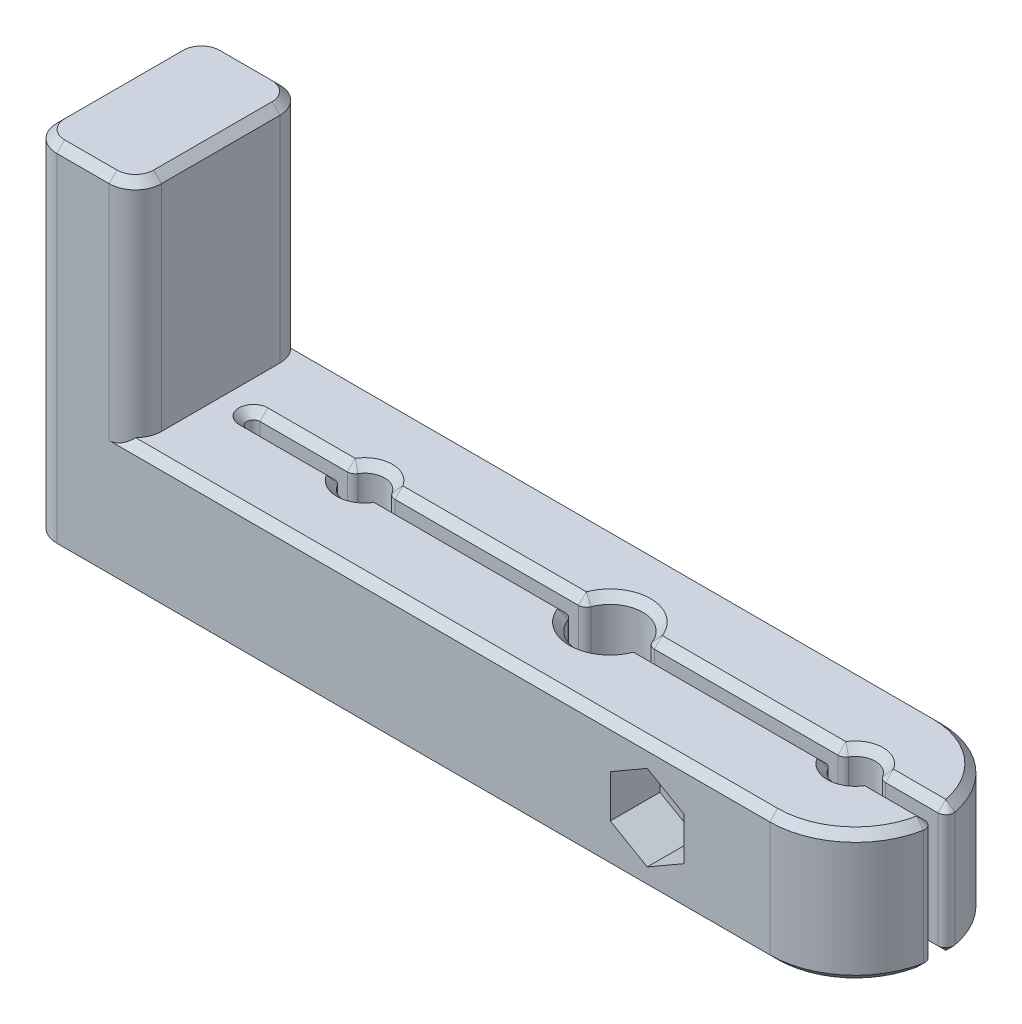
from build123d import *

# Parameters (mm, degrees)
SKETCH1_R               = 1.525
SKETCH1_R_2             = 2.5
SKETCH1_R_3             = 1.5
MAIN_BODY_DEPTH         = 10
SKETCH1_4_R             = 2.5
LEAD_SCREW_CUTOUT_DEPTH = 40.593410121
LIMIT_SWITCH_TAB_DEPTH  = 17
CUT_EXTRUDE1_DEPTH      = 42.912266999
FILLET1_R               = 0.6
CHAMFER1_SIZE           = 0.6
CUT_EXTRUDE2_DEPTH      = 3.8
CUT_EXTRUDE3_DEPTH      = 49.211668712
CUT_EXTRUDE4_DEPTH      = 3.3


with BuildPart() as part:
    # Sketch1 → Main body (new body)
    # profile 1 of 3: a face of its own
    with BuildSketch(Plane(origin=(0, 0, 0), x_dir=(1, 0, 0), z_dir=(0, 1, 0))):
        with BuildLine():
            Line((18.75, 6.525), (-18.75, 6.525))
            Line((-18.75, 6.525), (-35.75, 6.525))
            ThreePointArc((-35.75, 6.525), (-37.164213562, 5.939213562), (-37.75, 4.525))
            Line((-37.75, 4.525), (-37.75, -4.525))
            ThreePointArc((-37.75, -4.525), (-37.164213562, -5.939213562), (-35.75, -6.525))
            Line((-35.75, -6.525), (-18.75, -6.525))
            Line((-18.75, -6.525), (18.75, -6.525))
            ThreePointArc((18.75, -6.525), (25.275, 0), (18.75, 6.525))
        make_face()
        with Locations(Location((-18.75, 0, 0), (0, 0, 270))):
            Circle(SKETCH1_R, mode=Mode.SUBTRACT)
        Circle(SKETCH1_R_2, mode=Mode.SUBTRACT)
        with Locations(Location((18.75, 0, 0), (0, 0, 270))):
            Circle(SKETCH1_R, mode=Mode.SUBTRACT)
    # profile 2 of 3: a face of its own
    with BuildSketch(Plane(origin=(0, 0, 0), x_dir=(1, 0, 0), z_dir=(0, 1, 0))):
        Circle(SKETCH1_R_2)
        Circle(SKETCH1_R_3, mode=Mode.SUBTRACT)
    # profile 3 of 3: a face of its own
    with BuildSketch(Plane(origin=(0, 0, 0), x_dir=(1, 0, 0), z_dir=(0, 1, 0))):
        Circle(SKETCH1_R_3)
    extrude(amount=MAIN_BODY_DEPTH)

    # Sketch1<4> → Lead screw cutout (cut, through all)
    with BuildSketch(Plane(origin=(0, 0, 0), x_dir=(1, 0, 0), z_dir=(0, 1, 0))):
        with Locations(Location((0, 0, 0), (0, 0, 270))):
            Circle(SKETCH1_4_R)
    extrude(amount=LEAD_SCREW_CUTOUT_DEPTH, mode=Mode.SUBTRACT)

    # Limit switch tab sketch → Limit switch tab (add)
    with BuildSketch(Plane(origin=(0, 10, 0), x_dir=(1, 0, 0), z_dir=(0, 1, 0))):
        with BuildLine():
            Line((-37.75, 4.525), (-37.75, -4.525))
            ThreePointArc((-37.75, -4.525), (-37.164213562, -5.939213562), (-35.75, -6.525))
            Line((-35.75, -6.525), (-31.75, -6.525))
            ThreePointArc((-31.75, -6.525), (-30.335786438, -5.939213562), (-29.75, -4.525))
            Line((-29.75, -4.525), (-29.75, 4.525))
            ThreePointArc((-29.75, 4.525), (-30.335786438, 5.939213562), (-31.75, 6.525))
            Line((-31.75, 6.525), (-35.75, 6.525))
            ThreePointArc((-35.75, 6.525), (-37.164213562, 5.939213562), (-37.75, 4.525))
        make_face()
    extrude(amount=LIMIT_SWITCH_TAB_DEPTH)

    # Sketch2 → Cut-Extrude1 (cut, through all)
    with BuildSketch(Plane(origin=(0, 10, 0), x_dir=(1, 0, 0), z_dir=(0, 1, 0))):
        with BuildLine():
            Line((-27.25, 0.5), (27.993605311, 0.5))
            Line((27.993605311, 0.5), (27.993605311, -0.5))
            Line((27.993605311, -0.5), (-27.25, -0.5))
            ThreePointArc((-27.25, -0.5), (-27.75, 0), (-27.25, 0.5))
        make_face()
    extrude(amount=-CUT_EXTRUDE1_DEPTH, mode=Mode.SUBTRACT)

    # Fillet1
    fillet1_edges = [part.edges().sort_by_distance(p)[0] for p in [
        (2.449489743, 5, 0.5),
        (-2.449489743, 5, 0.5),
        (-2.449489743, 5, -0.5),
        (2.449489743, 5, -0.5),
        (-17.309297047, 5, -0.5),
        (-20.190702953, 5, -0.5),
        (20.190702953, 5, -0.5),
        (17.309297047, 5, -0.5),
        (25.255814707, 5, -0.5),
        (-20.190702953, 5, 0.5),
        (-17.309297047, 5, 0.5),
        (17.309297047, 5, 0.5),
        (20.190702953, 5, 0.5),
        (25.255814707, 5, 0.5),
    ]]
    fillet(fillet1_edges, radius=FILLET1_R)

    # Chamfer1
    chamfer1_edges = [part.edges().sort_by_distance(p)[0] for p in [
        (22.913609585, 0, -5.023940706),
        (-8.5, 0, 6.525),
        (-37.164213562, 0, 5.939213562),
        (-37.75, 0, 0),
        (9.915068783, 10, -0.5),
        (9.915068783, 0, -0.5),
        (22.570066358, 0, -0.5),
        (-37.164213562, 0, -5.939213562),
        (18.75, 0, -1.525),
        (0, 0, -2.5),
        (-9.915068783, 0, -0.5),
        (-18.75, 0, -1.525),
        (-23.909068892, 0, -0.5),
        (-18.75, 0, 1.525),
        (-9.915068783, 0, 0.5),
        (0, 0, 2.5),
        (-8.5, 0, -6.525),
        (9.915068783, 0, 0.5),
        (18.75, 0, 1.525),
        (22.570066358, 0, 0.5),
        (22.913609585, 0, 5.023940706),
        (-20.273479457, 0, -0.577337135),
        (-17.226520543, 0, -0.577337135),
        (-20.273479457, 0, 0.577337135),
        (-17.226520543, 0, 0.577337135),
        (-2.557498249, 0, 0.606167065),
        (-2.557498249, 0, -0.606167065),
        (2.557498249, 0, 0.606167065),
        (17.226520543, 0, -0.577337135),
        (17.226520543, 0, 0.577337135),
        (20.273479457, 0, 0.577337135),
        (20.273479457, 0, -0.577337135),
        (25.033966492, 0, -0.717139348),
        (25.033966492, 0, 0.717139348),
        (2.557498249, 0, -0.606167065),
        (0, 10, -2.5),
        (22.570066358, 10, -0.5),
        (22.913609585, 10, 5.023940706),
        (22.570066358, 10, 0.5),
        (18.75, 10, 1.525),
        (9.915068783, 10, 0.5),
        (0, 10, 2.5),
        (-9.915068783, 10, 0.5),
        (-18.75, 10, 1.525),
        (-23.909068892, 10, -0.5),
        (-18.75, 10, -1.525),
        (-9.915068783, 10, -0.5),
        (18.75, 10, -1.525),
        (-20.273479457, 10, -0.577337135),
        (-17.226520543, 10, -0.577337135),
        (-20.273479457, 10, 0.577337135),
        (-17.226520543, 10, 0.577337135),
        (-2.557498249, 10, 0.606167065),
        (-2.557498249, 10, -0.606167065),
        (2.557498249, 10, 0.606167065),
        (17.226520543, 10, -0.577337135),
        (17.226520543, 10, 0.577337135),
        (20.273479457, 10, 0.577337135),
        (20.273479457, 10, -0.577337135),
        (25.033966492, 10, -0.717139348),
        (25.033966492, 10, 0.717139348),
        (2.557498249, 10, -0.606167065),
        (-6.5, 10, -6.525),
        (-6.5, 10, 6.525),
        (-37.164213562, 27, 5.939213562),
        (-33.75, 27, 6.525),
        (-30.335786438, 27, 5.939213562),
        (-29.75, 27, 0),
        (-30.335786438, 27, -5.939213562),
        (-33.75, 27, -6.525),
        (-37.164213562, 27, -5.939213562),
        (-37.75, 27, 0),
        (22.913609585, 10, -5.023940706),
        (-23.909068892, 0, 0.5),
        (-27.75, 0, 0),
        (-27.75, 10, 0),
        (-23.909068892, 10, 0.5),
    ]]
    chamfer(chamfer1_edges, length=CHAMFER1_SIZE - 0.0001)  # a hair under: the kernel refuses the full size

    # Sketch3 → Cut-Extrude2 (cut)
    # profile 1 of 2: a face of its own
    with BuildSketch(Plane.XY.offset(6.525)):
        Polygon((12.2, 3.36898549), (12.2, 6.63101451), (9.375, 8.262029021), (6.55, 6.63101451), (6.55, 3.36898549), (9.375, 1.737970979), align=None)
        with BuildLine():
            ThreePointArc((8.346539825, 6.225671109), (9.375, 3.4), (10.403460175, 6.225671109))
            Line((10.403460175, 6.225671109), (9.375, 7.088651663))
            Line((9.375, 7.088651663), (8.346539825, 6.225671109))
        make_face(mode=Mode.SUBTRACT)
    # profile 2 of 2: a face of its own
    with BuildSketch(Plane.XY.offset(6.525)):
        with BuildLine():
            Line((9.375, 7.088651663), (8.346539825, 6.225671109))
            ThreePointArc((8.346539825, 6.225671109), (9.375, 3.4), (10.403460175, 6.225671109))
            Line((10.403460175, 6.225671109), (9.375, 7.088651663))
        make_face()
    extrude(amount=-CUT_EXTRUDE2_DEPTH, mode=Mode.SUBTRACT)

    # Sketch3<3> → Cut-Extrude3 (cut, through all)
    with BuildSketch(Plane.XY.offset(6.525)):
        with BuildLine():
            Line((9.375, 7.088651663), (8.346539825, 6.225671109))
            ThreePointArc((8.346539825, 6.225671109), (9.375, 3.4), (10.403460175, 6.225671109))
            Line((10.403460175, 6.225671109), (9.375, 7.088651663))
        make_face()
    extrude(amount=-CUT_EXTRUDE3_DEPTH, mode=Mode.SUBTRACT)

    # Sketch4 → Cut-Extrude4 (cut)
    with BuildSketch(Plane(origin=(0, 0, -6.525), x_dir=(-1, 0, 0), z_dir=(0, 0, -1))):
        with BuildLine():
            Line((-9.375, 8.687775592), (-11.190874997, 7.164075552))
            ThreePointArc((-11.190874997, 7.164075552), (-9.375, 2.175), (-7.559125003, 7.164075552))
            Line((-7.559125003, 7.164075552), (-9.375, 8.687775592))
        make_face()
    extrude(amount=-CUT_EXTRUDE4_DEPTH, mode=Mode.SUBTRACT)


solid = part.part
